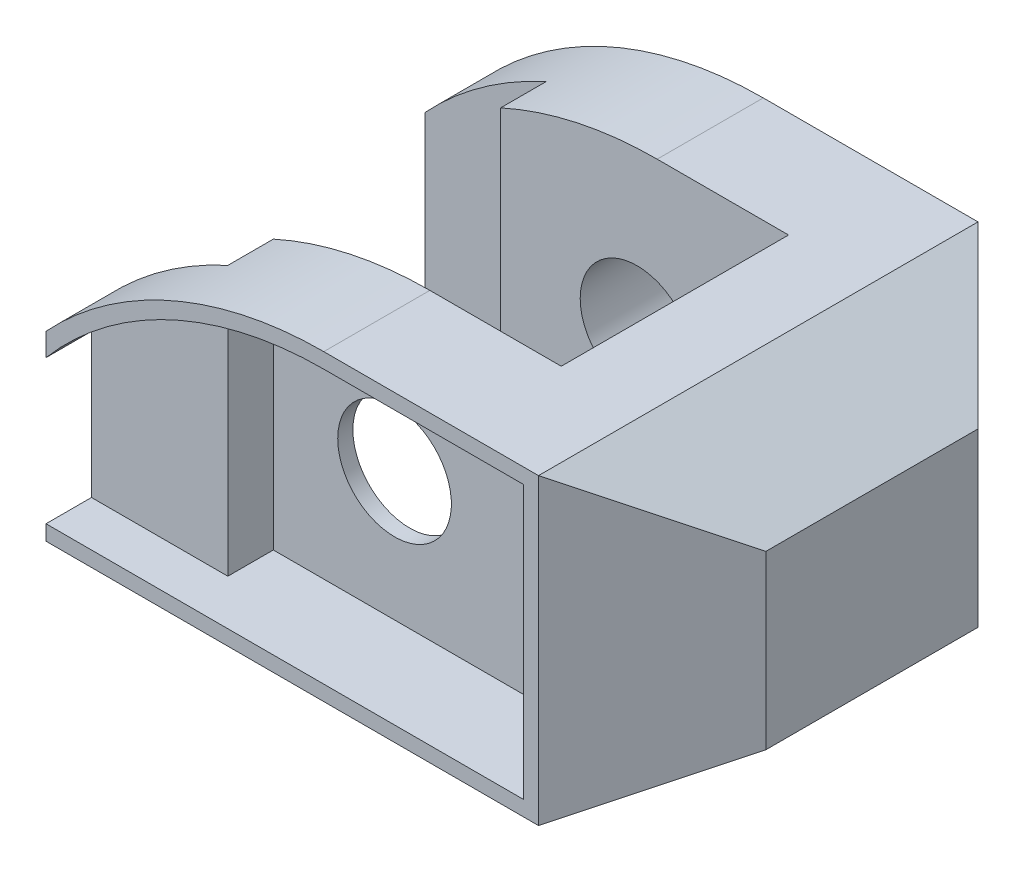
from build123d import *

# Parameters (mm, degrees)
SKETCH1_R           = 7.5
BOSS_EXTRUDE1_DEPTH = 58
SKETCH2_W           = 16
SKETCH2_H           = 42
CUT_EXTRUDE1_DEPTH  = 107.60206377
SKETCH3_W           = 38
SKETCH3_H           = 30
CUT_EXTRUDE2_DEPTH  = 107.60206377
CUT_EXTRUDE3_DEPTH  = 107.60206377
CUT_EXTRUDE4_DEPTH  = 6
CUT_EXTRUDE5_DEPTH  = 6


with BuildPart() as part:
    # Sketch1 → Boss-Extrude1 (new body)
    with BuildSketch(Plane.XY):
        with BuildLine():
            Line((0, 0), (65, 0))
            Line((65, 0), (80, 8.660254038))
            Line((80, 8.660254038), (80, 31.339745962))
            Line((80, 31.339745962), (65, 40))
            Line((65, 40), (36.66060556, 40))
            ThreePointArc((36.66060556, 40), (16.66060556, 35.82575695), (0, 24))
            Line((0, 24), (0, 0))
        make_face()
        with Locations((34, 19)):
            Circle(SKETCH1_R, mode=Mode.SUBTRACT)
    extrude(amount=BOSS_EXTRUDE1_DEPTH)

    # Sketch2 → Cut-Extrude1 (cut, through all)
    with BuildSketch(Plane(origin=(0, 0, 0), x_dir=(1, 0, 0), z_dir=(0, 1, 0))):
        with Locations((8, -29)):
            Rectangle(SKETCH2_W, SKETCH2_H)
    extrude(amount=CUT_EXTRUDE1_DEPTH, mode=Mode.SUBTRACT)

    # Sketch3 → Cut-Extrude2 (cut, through all)
    with BuildSketch(Plane(origin=(0, 0, 0), x_dir=(1, 0, 0), z_dir=(0, 1, 0))):
        with Locations((35, -29)):
            Rectangle(SKETCH3_W, SKETCH3_H)
    extrude(amount=CUT_EXTRUDE2_DEPTH, mode=Mode.SUBTRACT)

    # Sketch4 → Cut-Extrude3 (cut, through all)
    with BuildSketch(Plane(origin=(0, 0, 0), x_dir=(1, 0, 0), z_dir=(0, 1, 0))):
        Polygon((65, 0), (80, -15), (80, 0), align=None)
        Polygon((65, -58), (80, -43), (80, -58), align=None)
    extrude(amount=CUT_EXTRUDE3_DEPTH, mode=Mode.SUBTRACT)

    # Sketch5 → Cut-Extrude4 (cut)
    with BuildSketch(Plane.XY.offset(58)):
        with BuildLine():
            Line((0, 2), (0, 20.98386677))
            ThreePointArc((0, 20.98386677), (16.452013389, 33.538635744), (36.66060556, 38))
            Line((36.66060556, 38), (63, 38))
            Line((63, 38), (63, 2))
            Line((63, 2), (0, 2))
        make_face()
    extrude(amount=-CUT_EXTRUDE4_DEPTH, mode=Mode.SUBTRACT)

    # Sketch7 → Cut-Extrude5 (cut)
    with BuildSketch(Plane.XY.offset(52)):
        with BuildLine():
            Line((18, 34.224221872), (18, 2))
            Line((18, 2), (63, 2))
            Line((63, 2), (63, 38))
            Line((63, 38), (36.66060556, 38))
            ThreePointArc((36.66060556, 38), (27.141221384, 37.046586751), (18, 34.224221872))
        make_face()
    extrude(amount=-CUT_EXTRUDE5_DEPTH, mode=Mode.SUBTRACT)


solid = part.part
